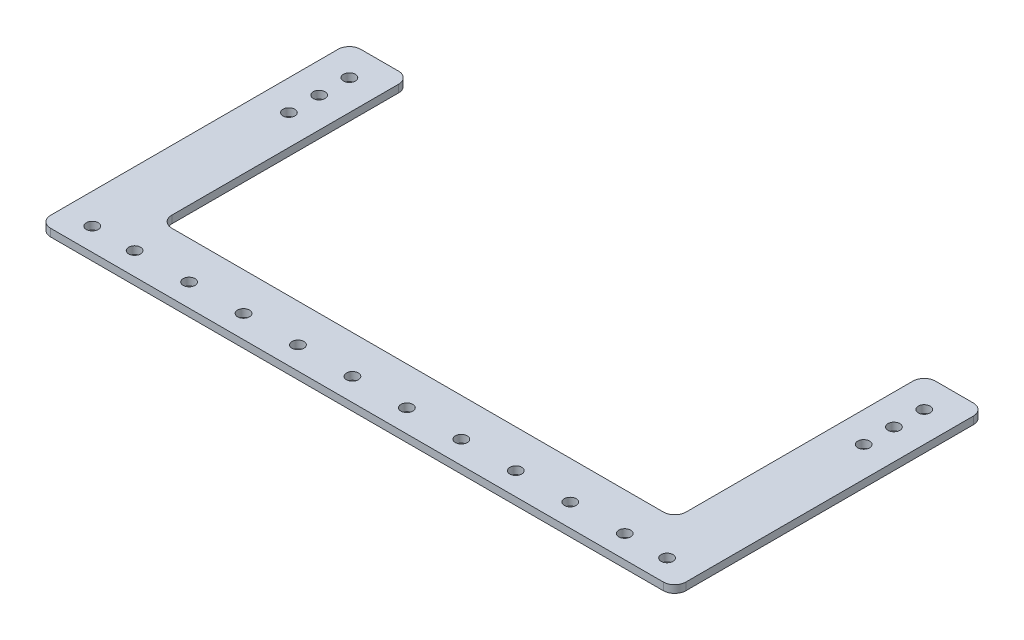
from build123d import *

# Parameters (mm, degrees)
SKETCH2_R           = 2.4892
BOSS_EXTRUDE1_DEPTH = 3.175
FILLET1_R           = 4.7625
SKETCH3_R           = 2.4892
CUT_EXTRUDE1_DEPTH  = 149.42063799


with BuildPart() as part:
    # Sketch2 → Boss-Extrude1 (new body)
    with BuildSketch(Plane(origin=(0, 0, 0), x_dir=(1, 0, 0), z_dir=(0, 1, 0))):
        Polygon((-133.35, 65.0875), (-133.35, -65.0875), (133.35, -65.0875), (133.35, 65.0875), (107.95, 65.0875), (107.95, -39.624), (-107.95, -39.624), (-107.95, 65.0875), align=None)
        with Locations((-120.65, 26.9875)):
            Circle(SKETCH2_R, mode=Mode.SUBTRACT)
        with Locations((-120.65, 39.6875)):
            Circle(SKETCH2_R, mode=Mode.SUBTRACT)
        with Locations((-120.65, 52.3875)):
            Circle(SKETCH2_R, mode=Mode.SUBTRACT)
        with Locations((120.65, 26.9875)):
            Circle(SKETCH2_R, mode=Mode.SUBTRACT)
        with Locations((120.65, 39.6875)):
            Circle(SKETCH2_R, mode=Mode.SUBTRACT)
        with Locations((120.65, 52.3875)):
            Circle(SKETCH2_R, mode=Mode.SUBTRACT)
    extrude(amount=BOSS_EXTRUDE1_DEPTH)

    # Fillet1
    fillet1_edges = [part.edges().sort_by_distance(p)[0] for p in [
        (133.35, 1.5875, -65.0875),
        (-133.35, 1.5875, 65.0875),
        (-133.35, 1.5875, -65.0875),
        (-107.95, 1.5875, -65.0875),
        (-107.95, 1.5875, 39.624),
        (107.95, 1.5875, 39.624),
        (107.95, 1.5875, -65.0875),
        (133.35, 1.5875, 65.0875),
    ]]
    fillet(fillet1_edges, radius=FILLET1_R)

    # Sketch3 → Cut-Extrude1 (cut, through all)
    with BuildSketch(Plane(origin=(0, 3.175, 0), x_dir=(1, 0, 0), z_dir=(0, 1, 0))):
        with Locations((-102.87, -55.5625)):
            Circle(SKETCH3_R)
        with Locations((-80.01, -55.5625)):
            Circle(SKETCH3_R)
        with Locations((-120.65, -55.5625)):
            Circle(SKETCH3_R)
        with Locations((-57.15, -55.5625)):
            Circle(SKETCH3_R)
        with Locations((120.65, -55.5625)):
            Circle(SKETCH3_R)
        with Locations((-34.29, -55.5625)):
            Circle(SKETCH3_R)
        with Locations((-11.43, -55.5625)):
            Circle(SKETCH3_R)
        with Locations((11.43, -55.5625)):
            Circle(SKETCH3_R)
        with Locations((34.29, -55.5625)):
            Circle(SKETCH3_R)
        with Locations((57.15, -55.5625)):
            Circle(SKETCH3_R)
        with Locations((80.01, -55.5625)):
            Circle(SKETCH3_R)
        with Locations((102.87, -55.5625)):
            Circle(SKETCH3_R)
    extrude(amount=-CUT_EXTRUDE1_DEPTH, mode=Mode.SUBTRACT)


solid = part.part
